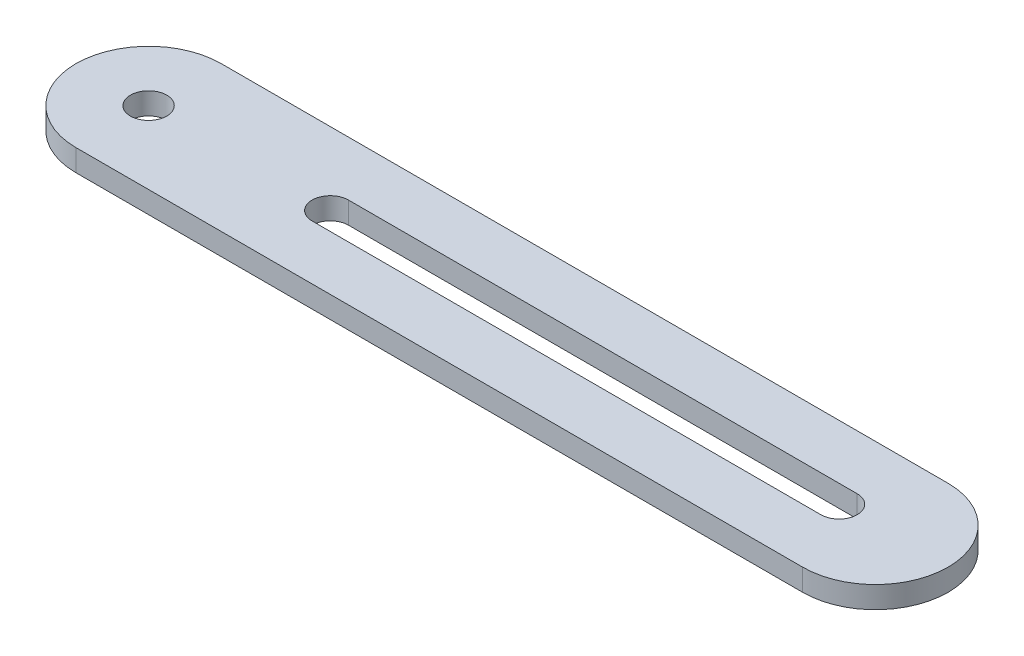
from build123d import *

# Parameters (mm, degrees)
SKETCH1_R          = 2.5
BASE_FLANGE1_DEPTH = 3


# Sheet-metal steps are written as plain solids
with BuildPart() as part:
    # Sketch1 → Base-Flange1 (new body)
    with BuildSketch(Plane(origin=(0, 0, 0), x_dir=(1, 0, 0), z_dir=(0, 1, 0))):
        with BuildLine():
            Line((-50, 10), (50, 10))
            ThreePointArc((50, 10), (60, 0), (50, -10))
            Line((50, -10), (-50, -10))
            ThreePointArc((-50, -10), (-60, 0), (-50, 10))
        make_face()
        with Locations(Location((-50, 0, 0), (0, 0, 270))):
            Circle(SKETCH1_R, mode=Mode.SUBTRACT)
        with BuildLine():
            Line((-25, 2.5), (45, 2.5))
            ThreePointArc((45, 2.5), (47.5, 0), (45, -2.5))
            Line((45, -2.5), (-25, -2.5))
            ThreePointArc((-25, -2.5), (-27.5, 0), (-25, 2.5))
        make_face(mode=Mode.SUBTRACT)
    extrude(amount=-BASE_FLANGE1_DEPTH)


solid = part.part
